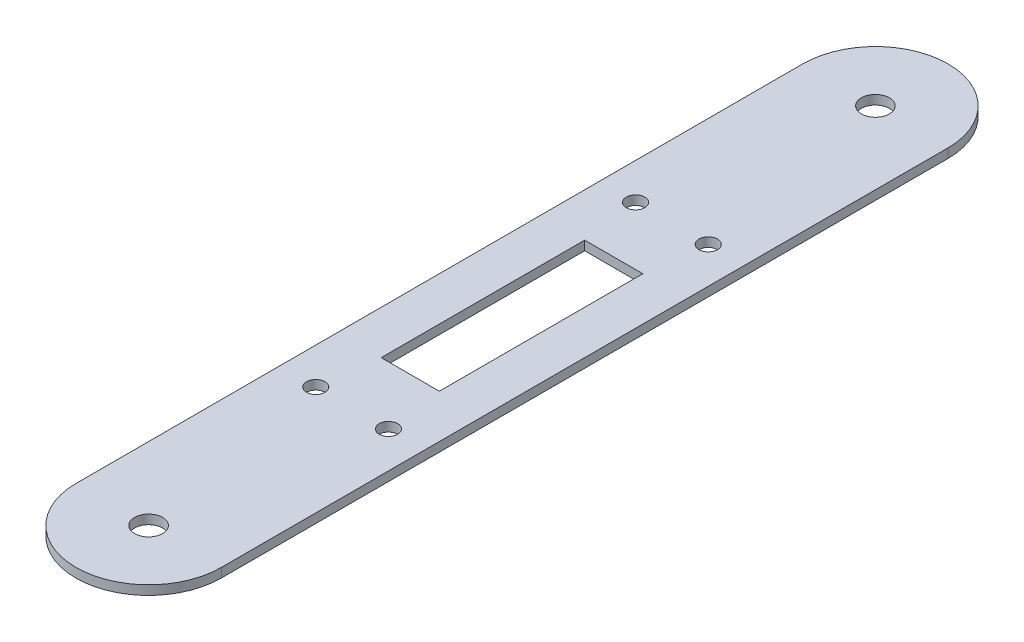
from build123d import *

# Parameters (mm, degrees)
SKETCH1_R           = 4.82
SKETCH1_R_2         = 3.175
SKETCH1_W           = 20
SKETCH1_H           = 70
BOSS_EXTRUDE1_DEPTH = 3.175


with BuildPart() as part:
    # Sketch1 → Boss-Extrude1 (new body)
    with BuildSketch(Plane(origin=(0, 0, 0), x_dir=(1, 0, 0), z_dir=(0, 1, 0))):
        with BuildLine():
            ThreePointArc((50, -25), (25, 0), (0, -25))
            Line((0, -25), (0, -274.999999959))
            ThreePointArc((0, -274.999999959), (24.999999979, -300), (50, -275))
            Line((50, -275), (50, -25))
        make_face()
        with Locations((25, -25)):
            Circle(SKETCH1_R, mode=Mode.SUBTRACT)
        with Locations((37.5, -95)):
            Circle(SKETCH1_R_2, mode=Mode.SUBTRACT)
        with Locations((12.5, -205)):
            Circle(SKETCH1_R_2, mode=Mode.SUBTRACT)
        with Locations((37.5, -205)):
            Circle(SKETCH1_R_2, mode=Mode.SUBTRACT)
        with Locations((12.5, -95)):
            Circle(SKETCH1_R_2, mode=Mode.SUBTRACT)
        with Locations((25, -150)):
            Rectangle(SKETCH1_W, SKETCH1_H, mode=Mode.SUBTRACT)
        with Locations((25, -275)):
            Circle(SKETCH1_R, mode=Mode.SUBTRACT)
    extrude(amount=BOSS_EXTRUDE1_DEPTH)


solid = part.part
